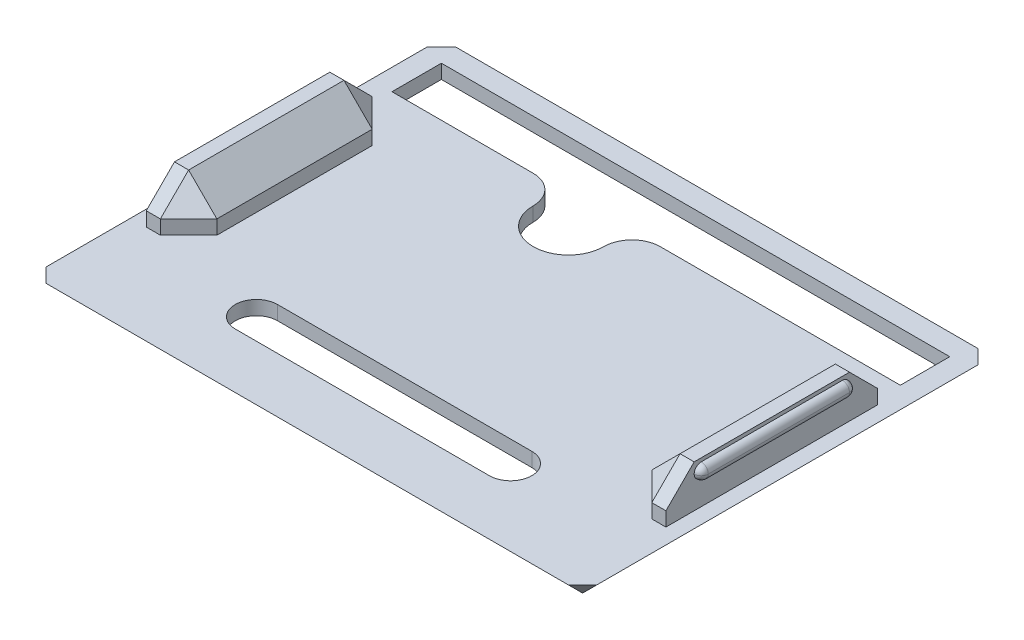
from build123d import *

# Parameters (mm, degrees)
SKETCH1_W           = 39
SKETCH1_H           = 29
BOSS_EXTRUDE1_DEPTH = 1
SKETCH2_W           = 3
SKETCH2_H           = 15
BOSS_EXTRUDE2_DEPTH = 3
CHAMFER1_SIZE       = 1
CHAMFER2_SIZE       = 2
SKETCH3_W           = 11
SKETCH3_H           = 1
BOSS_EXTRUDE3_DEPTH = 0.5
FILLET1_R           = 0.5
CUT_EXTRUDE1_REACH  = 26.627
CUT_EXTRUDE2_REACH  = 26.627
SKETCH5_W           = 36
SKETCH5_H           = 3.5
CUT_EXTRUDE3_REACH  = 26.627
FILLET2_R           = 2


# Read off the part's stored shape, not the designer's step: Mirror1
# Some blends are built 0.0001 mm under size
with BuildPart() as part:
    # Sketch1 → Boss-Extrude1 (new body)
    with BuildSketch(Plane(origin=(0, 0, 0), x_dir=(1, 0, 0), z_dir=(0, 1, 0))):
        Rectangle(SKETCH1_W, SKETCH1_H)
    extrude(amount=BOSS_EXTRUDE1_DEPTH)

    # Sketch2 → Boss-Extrude2 (add)
    with BuildSketch(Plane(origin=(0, 1, 0), x_dir=(1, 0, 0), z_dir=(0, 1, 0))):
        with Locations((-16.9, 0)):
            Rectangle(SKETCH2_W, SKETCH2_H)
        with Locations((16.9, 0)):
            Rectangle(SKETCH2_W, SKETCH2_H)
    extrude(amount=BOSS_EXTRUDE2_DEPTH)

    # Chamfer1
    chamfer1_edges = [part.edges().sort_by_distance(p)[0] for p in [
        (0, 0, 14.5),
        (-19.5, 0, 0),
        (0, 0, -14.5),
        (19.5, 0, 0),
        (19.5, 0.5, 14.5),
        (-19.5, 0.5, 14.5),
        (-19.5, 0.5, -14.5),
        (19.5, 0.5, -14.5),
    ]]
    chamfer(chamfer1_edges, length=CHAMFER1_SIZE - 0.0001)  # a hair under: the kernel refuses the full size

    # Chamfer2
    chamfer2_edges = [part.edges().sort_by_distance(p)[0] for p in [
        (-15.4, 2.5, 7.5),
        (-15.4, 2.5, -7.5),
        (-16.9, 4, 7.5),
        (-15.4, 4, 0),
        (-16.9, 4, -7.5),
        (15.4, 2.5, -7.5),
        (15.4, 2.5, 7.5),
        (16.9, 4, -7.5),
        (15.4, 4, 0),
        (16.9, 4, 7.5),
    ]]
    chamfer(chamfer2_edges, length=CHAMFER2_SIZE)

    # Sketch3 → Boss-Extrude3 (add)
    with BuildSketch(Plane(origin=(18.4, 0, 0), x_dir=(0, 0, -1), z_dir=(1, 0, 0))):
        with Locations((0, 3.25)):
            Rectangle(SKETCH3_W, SKETCH3_H)
    extrude(amount=BOSS_EXTRUDE3_DEPTH)

    # Fillet1
    # the kernel refuses this fillet: 0.5 mm, written as the material it adds along each edge
    # the kernel refuses this fillet: 0.5 mm, written as the material it takes off along each edge
    with BuildSketch(Plane(origin=(18.4, 3.25, 5), x_dir=(1, 0, 0), z_dir=(0, 0, 1))) as fillet1_2_piece_1_section:
        Polygon((0, 0), (FILLET1_R * 1.02, 0), (FILLET1_R * 1.02, FILLET1_R * 1.02), (0, FILLET1_R * 1.02), align=None)
    fillet1_2_piece_1 = extrude(amount=FILLET1_R * 1.02, mode=Mode.PRIVATE)
    fillet1_2_piece_1 = fillet1_2_piece_1 - Plane(origin=(18.4, 3.25, 5), x_dir=(-0.7071067811865475, -0.7071067811865475, 0), z_dir=(0, 0, 1)) * Sphere(FILLET1_R, mode=Mode.PRIVATE)
    with BuildSketch(Plane(origin=(18.4, 3.25, 5), x_dir=(0, 0, 1), z_dir=(0, -1, 0))) as fillet1_2_piece_2_section:
        Polygon((0, 0), (FILLET1_R * 1.02, 0), (FILLET1_R * 1.02, -FILLET1_R * 1.02), (0, -FILLET1_R * 1.02), align=None)
    fillet1_2_piece_2 = extrude(amount=FILLET1_R * 1.02, mode=Mode.PRIVATE)
    fillet1_2_piece_2 = fillet1_2_piece_2 - Plane(origin=(18.4, 3.25, 5), x_dir=(-0.7071067811865475, 0, -0.7071067811865475), z_dir=(0, -1, 0)) * Sphere(FILLET1_R, mode=Mode.PRIVATE)
    with BuildSketch(Plane(origin=(18.4, 3.25, -5), x_dir=(0, -1, 0), z_dir=(0, 0, -1))) as fillet1_2_piece_3_section:
        Polygon((0, 0), (FILLET1_R * 1.02, 0), (FILLET1_R * 1.02, -FILLET1_R * 1.02), (0, -FILLET1_R * 1.02), align=None)
    fillet1_2_piece_3 = extrude(amount=FILLET1_R * 1.02, mode=Mode.PRIVATE)
    fillet1_2_piece_3 = fillet1_2_piece_3 - Plane(origin=(18.4, 3.25, -5), x_dir=(-0.7071067811865475, 0.7071067811865475, 0), z_dir=(0, 0, -1)) * Sphere(FILLET1_R, mode=Mode.PRIVATE)
    with BuildSketch(Plane(origin=(18.4, 3.25, -5), x_dir=(1, 0, 0), z_dir=(0, 0, -1))) as fillet1_2_piece_4_section:
        Polygon((0, 0), (FILLET1_R * 1.02, 0), (FILLET1_R * 1.02, -FILLET1_R * 1.02), (0, -FILLET1_R * 1.02), align=None)
    fillet1_2_piece_4 = extrude(amount=FILLET1_R * 1.02, mode=Mode.PRIVATE)
    fillet1_2_piece_4 = fillet1_2_piece_4 - Plane(origin=(18.4, 3.25, -5), x_dir=(-0.7071067811865475, -0.7071067811865475, 0), z_dir=(0, 0, -1)) * Sphere(FILLET1_R, mode=Mode.PRIVATE)
    with BuildSketch(Plane(origin=(18.9, 2.75, -5), x_dir=(-1, 0, 0), z_dir=(0, 0, 1)), Plane(origin=(18.9, 3.75, 5), x_dir=(-1, 0, 0), z_dir=(0, 0, -1))) as fillet1_2_piece_5:
        with BuildLine():
            CenterArc((FILLET1_R, -FILLET1_R), FILLET1_R, 90, 90)
            Line((0, -FILLET1_R), (0, 0))
            Line((0, 0), (FILLET1_R, 0))
        make_face()
    fillet1_2_piece_5_solid = extrude(amount=10, mode=Mode.PRIVATE)
    add([fillet1_2_piece_1, fillet1_2_piece_2, fillet1_2_piece_3, fillet1_2_piece_4, fillet1_2_piece_5_solid], mode=Mode.SUBTRACT)

    # Mirror1 outline → Mirror1 (revolve)
    with BuildSketch(Plane(origin=(-18.4, 3.25, 0), x_dir=(1, 0, 0), z_dir=(0, -1, 0))):
        with BuildLine():
            Line((0, 5.5), (0, -5.5))
            ThreePointArc((0, -5.5), (0.353553391, -5.353553391), (0.5, -5))
            Line((0.5, -5), (0.5, 5))
            ThreePointArc((0.5, 5), (0.353553391, 5.353553391), (0, 5.5))
        make_face()
    revolve(axis=Axis((-18.4, 3.25, 0), (0, 0, 1)))

    # Sketch4 → Cut-Extrude1 (cut, up to next)
    with BuildSketch(Plane.XZ, mode=Mode.PRIVATE) as cut_extrude1_sk1:
        with BuildLine():
            Line((9, 7.6), (-9, 7.6))
            ThreePointArc((-9, 7.6), (-10.5, 9.1), (-9, 10.6))
            Line((-9, 10.6), (9, 10.6))
            ThreePointArc((9, 10.6), (10.5, 9.1), (9, 7.6))
        make_face()
    cut_extrude1_tool1 = extrude(cut_extrude1_sk1.sketch, amount=-CUT_EXTRUDE1_REACH, mode=Mode.PRIVATE) & part.part
    add(cut_extrude1_tool1.solids().sort_by_distance((0, 0, 9.1))[0], mode=Mode.SUBTRACT)

    # Sketch5 → Cut-Extrude2 (cut, up to next)
    with BuildSketch(Plane(origin=(0, 0, 0), x_dir=(-1, 0, 0), z_dir=(0, -1, 0)), mode=Mode.PRIVATE) as cut_extrude2_sk1:
        with Locations((0, 11.25)):
            Rectangle(SKETCH5_W, SKETCH5_H)
    cut_extrude2_tool1 = extrude(cut_extrude2_sk1.sketch, amount=-CUT_EXTRUDE2_REACH, mode=Mode.PRIVATE) & part.part
    add(cut_extrude2_tool1.solids().sort_by_distance((0, 0, -11.25))[0], mode=Mode.SUBTRACT)

    # Sketch6 → Cut-Extrude3 (cut, up to next)
    with BuildSketch(Plane.XZ, mode=Mode.PRIVATE) as cut_extrude3_sk1:
        with BuildLine():
            Line((-6, -7.5), (-6, -9.5))
            Line((-6, -9.5), (-1, -9.5))
            Line((-1, -9.5), (-1, -7.5))
            ThreePointArc((-1, -7.5), (-3.5, -5), (-6, -7.5))
        make_face()
    cut_extrude3_tool1 = extrude(cut_extrude3_sk1.sketch, amount=-CUT_EXTRUDE3_REACH, mode=Mode.PRIVATE) & part.part
    add(cut_extrude3_tool1.solids().sort_by_distance((-3.5, 0, -7.478975))[0], mode=Mode.SUBTRACT)

    # Fillet2
    fillet2_edges = [part.edges().sort_by_distance(p)[0] for p in [
        (-6, 0.5, -9.5),
        (-1, 0.5, -9.5),
    ]]
    fillet(fillet2_edges, radius=FILLET2_R - 0.0001)  # a hair under: the kernel refuses the full size


solid = part.part
